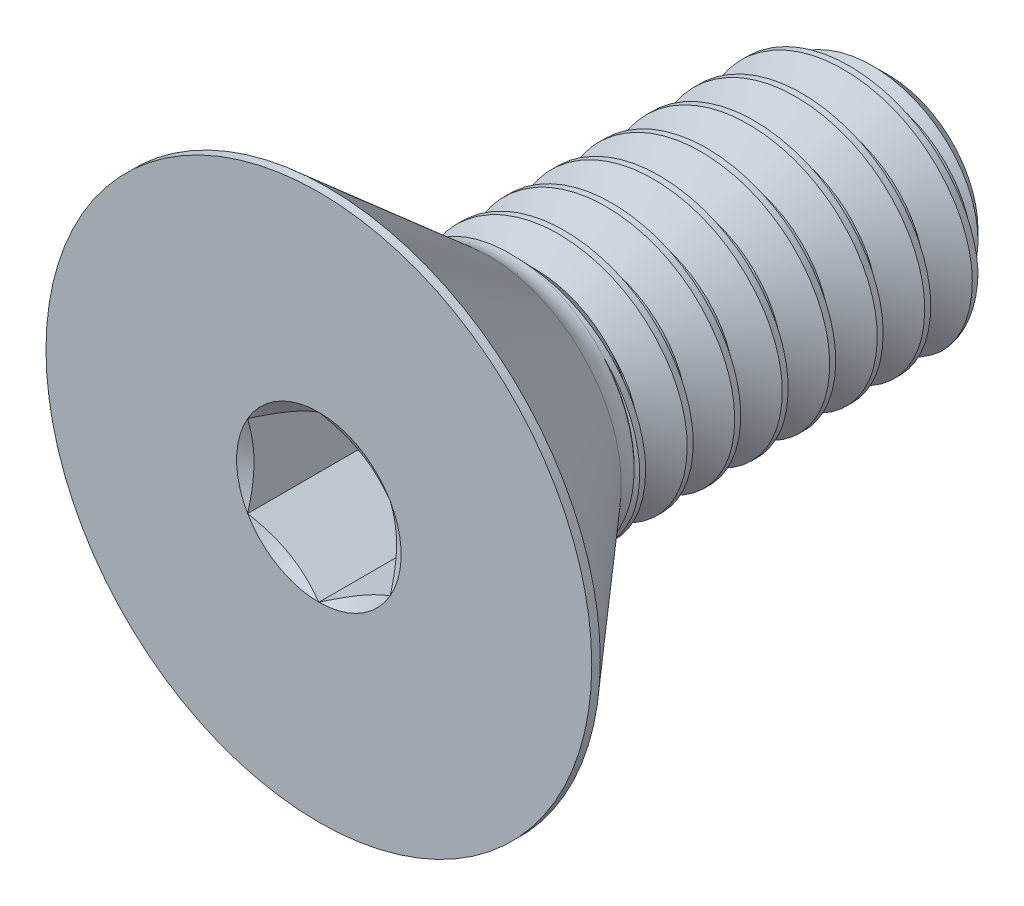
from build123d import *

# Parameters (mm, degrees)
SKETCH1_W          = 9.525
SKETCH1_H          = 2.0828
CHAMFER1_SIZE      = 0.5953125
CUT_SWEEP1_PITCH   = 0.79375
CUT_EXTRUDE2_DEPTH = 1.99136


with BuildPart() as part:
    # Sketch1 → Revolve1 (revolve)
    with BuildSketch(Plane(origin=(0, 0, 0), x_dir=(0, 0, -1), z_dir=(1, 0, 0))):
        with Locations((4.7625, 1.0414)):
            Rectangle(SKETCH1_W, SKETCH1_H)
    revolve(axis=Axis((0, 0, -9.525), (0, 0, 1)))

    # Chamfer1
    chamfer1_edges = [part.edges().sort_by_distance(p)[0] for p in [
        (0, -2.0828, -9.525),
    ]]
    chamfer(chamfer1_edges, length=CHAMFER1_SIZE)

    # Cut-Sweep1: the profile of Sketch2 profile screwed along a right-hand helix of 12 turns, 8 arcs to a turn; built about Z, then put on its axis
    cut_sweep1_z = Axis((0, 0, 0), (0, 0, 1))
    cut_sweep1_corners = [(2.0831, 0, 0.000173205), (2.0831, 0, -0.694704455), (1.567244252, 0, -0.396875), (1.567244252, 0, -0.29765625)]
    with BuildLine(mode=Mode.PRIVATE) as cut_sweep1_profile:
        Line(cut_sweep1_corners[0], cut_sweep1_corners[1])
        Line(cut_sweep1_corners[1], cut_sweep1_corners[2])
        Line(cut_sweep1_corners[2], cut_sweep1_corners[3])
        Line(cut_sweep1_corners[3], cut_sweep1_corners[0])
    cut_sweep1_cap = Face(cut_sweep1_profile.wire())
    cut_sweep1_turn_angles = [0, 22.5, 45, 67.5, 90, 112.5, 135, 157.5, 180, 202.5, 225, 247.5, 270, 292.5, 315, 337.5, 360]
    cut_sweep1_turn_weights = [1, 0.9238795325112867, 1, 0.9238795325112867, 1, 0.9238795325112867, 1, 0.9238795325112867, 1, 0.9238795325112867, 1, 0.9238795325112867, 1, 0.9238795325112867, 1, 0.9238795325112867, 1]
    cut_sweep1_turn_rails = [Edge.make_bspline([Vector(p[0], p[1], 0).rotate(cut_sweep1_z, cut_sweep1_turn_angles[k]) / cut_sweep1_turn_weights[k] + Vector(0, 0, p[2] + CUT_SWEEP1_PITCH * cut_sweep1_turn_angles[k] / 360) for k in range(17)], [0, 0, 0, 1, 1, 2, 2, 3, 3, 4, 4, 5, 5, 6, 6, 7, 7, 8, 8, 8], 2, cut_sweep1_turn_weights) for p in cut_sweep1_corners]
    cut_sweep1_turn_sides = [Face.make_surface_from_curves(cut_sweep1_turn_rails[p[0]], cut_sweep1_turn_rails[p[1]]) for p in [(0, 1), (1, 2), (2, 3), (3, 0)]]
    cut_sweep1 = Plane(origin=(0, 0, -9.525), x_dir=(0, 1, 0), z_dir=(0, 0, 1)) * Solid(Shell([*[p.moved(Location((0, 0, CUT_SWEEP1_PITCH * i))) for i in range(12) for p in cut_sweep1_turn_sides], cut_sweep1_cap, cut_sweep1_cap.rotate(cut_sweep1_z, 4320).moved(Location((0, 0, CUT_SWEEP1_PITCH * 4320 / 360)))]))
    add(cut_sweep1, mode=Mode.SUBTRACT)

    # Sketch7 → Revolve2 (revolve)
    with BuildSketch(Plane(origin=(0, 0, 0), x_dir=(0, 0, -1), z_dir=(1, 0, 0)), mode=Mode.PRIVATE) as revolve2_sk:
        with BuildLine():
            Line((0, 4.5593), (0.14224, 4.5593))
            Line((0.14224, 4.5593), (2.8448, 2.210000434))
            ThreePointArc((2.8448, 2.210000434), (3.003405714, 2.11563995), (3.185013014, 2.0828))
            Line((3.185013014, 2.0828), (3.185013014, 0))
            Line((3.185013014, 0), (0, 0))
            Line((0, 0), (0, 4.5593))
        make_face()
    revolve(revolve2_sk.sketch.rotate(Axis((0, 0, 0), (0, 0, -1)), 189.052465709), axis=Axis((0, 0, 0), (0, 0, -1)))

    # Boss-Extrude1 cone 1 section (through the dimple's axis) → Boss-Extrude1 (revolve)
    with BuildSketch(Plane(origin=(0, 0, -3.185013014), x_dir=(0, -1, 0), z_dir=(1, 0, 0))):
        Polygon((0, 0), (2.0828, 0), (0, 2.01133658), align=None)
    revolve(axis=Axis((0, 0, -3.185013014), (0, 0, -1)))

    # Sketch5 → Cut-Extrude2 (cut)
    with BuildSketch(Plane.XY):
        Polygon((0, 1.374815329), (-1.190625, 0.687407664), (-1.190625, -0.687407664), (0, -1.374815329), (1.190625, -0.687407664), (1.190625, 0.687407664), align=None)
    extrude(amount=-CUT_EXTRUDE2_DEPTH, mode=Mode.SUBTRACT)

    # Cut-Extrude3 cone 1 section (through the dimple's axis) → Cut-Extrude3 (revolve, cut)
    with BuildSketch(Plane(origin=(0, 0, 0), x_dir=(0, -1, 0), z_dir=(1, 0, 0))):
        Polygon((0, 0), (1.374815329, 0), (0, 0.79375), align=None)
    revolve(axis=Axis((0, 0, 0), (0, 0, -1)), mode=Mode.SUBTRACT)


solid = part.part
